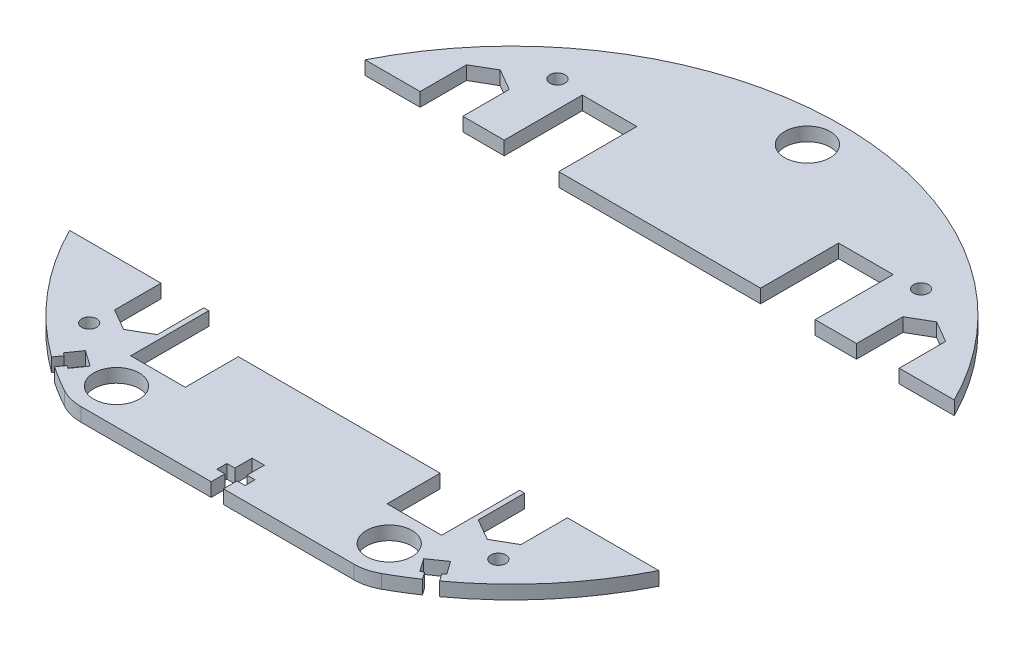
from build123d import *

# Parameters (mm, degrees)
BOSS_EXTRUDE1_DEPTH = 3
CUT_EXTRUDE1_DEPTH  = 103.574363269
CUT_EXTRUDE2_DEPTH  = 103.574363269
SKETCH4_R           = 5
CUT_EXTRUDE3_DEPTH  = 98.289516393
CUT_EXTRUDE4_DEPTH  = 98.289516393
SKETCH7_R           = 5
CUT_EXTRUDE6_DEPTH  = 98.289516393
CUT_EXTRUDE7_DEPTH  = 98.289516393
SKETCH9_R           = 1.65
CUT_EXTRUDE8_DEPTH  = 98.289516393
CUT_EXTRUDE9_DEPTH  = 98.289516393


with BuildPart() as part:
    # Sketch1 → Boss-Extrude1 (new body)
    with BuildSketch(Plane(origin=(0, 0, 0), x_dir=(1, 0, 0), z_dir=(0, 1, 0))):
        with BuildLine():
            Line((-30.029977361, -64.812867647), (30.029977361, -64.812867647))
            ThreePointArc((30.029977361, -64.812867647), (32.509837414, -64.500503794), (34.834773739, -63.582926471))
            ThreePointArc((34.834773739, -63.582926471), (0, 72.5), (-34.834773739, -63.582926471))
            ThreePointArc((-34.834773739, -63.582926471), (-32.509837414, -64.500503794), (-30.029977361, -64.812867647))
        make_face()
    extrude(amount=BOSS_EXTRUDE1_DEPTH)

    # Sketch2 → Cut-Extrude1 (cut, through all)
    with BuildSketch(Plane(origin=(0, 3, 0), x_dir=(1, 0, 0), z_dir=(0, 1, 0))):
        Polygon((-34.2, 49.675685802), (-34.2, -49.675685802), (-22.2, -49.675685802), (-22.2, -38), (22.2, -38), (22.2, -49.675685802), (34.2, -49.675685802), (34.2, 49.675685802), (22.2, 49.675685802), (22.2, 32.5), (19, 32.5), (19, 28.200685802), (-19, 28.200685802), (-19, 32.5), (-22.2, 32.5), (-22.2, 49.675685802), align=None)
    extrude(amount=-CUT_EXTRUDE1_DEPTH, mode=Mode.SUBTRACT)

    # Sketch3 → Cut-Extrude2 (cut, through all)
    with BuildSketch(Plane(origin=(0, 3, 0), x_dir=(1, 0, 0), z_dir=(0, 1, 0))):
        Polygon((34.2, -32.5), (-34.2, -32.5), (-72.5, -32.5), (-72.5, 32.5), (-34.2, 32.5), (34.2, 32.5), (72.5, 32.5), (72.5, -32.5), align=None)
    extrude(amount=-CUT_EXTRUDE2_DEPTH, mode=Mode.SUBTRACT)


with BuildPart() as cut_extrude2_piece_1:
    # of the separate pieces the step leaves, piece 1, a body of its own (cut_extrude2_pieces)
    add(part.part.solids().sort_by_distance((64.807406984, 0, -32.5))[0])


with BuildPart() as cut_extrude2_piece_2:
    # of the separate pieces the step leaves, piece 2, a body of its own (cut_extrude2_pieces)
    add(part.part.solids().sort_by_distance((-34.834773739, 0, 63.582926471))[0])

    # Sketch4 → Cut-Extrude3 (cut, through all)
    with BuildSketch(Plane(origin=(0, 3, 0), x_dir=(1, 0, 0), z_dir=(0, 1, 0))):
        with Locations((30, -57)):
            Circle(SKETCH4_R)
        with Locations((-30, -57)):
            Circle(SKETCH4_R)
    extrude(amount=-CUT_EXTRUDE3_DEPTH, mode=Mode.SUBTRACT)


with BuildPart() as cut_extrude4_tool:
    # Sketch5 → Cut-Extrude4 (new, through all)
    with BuildSketch(Plane(origin=(0, 3, 0), x_dir=(1, 0, 0), z_dir=(0, 1, 0))):
        Polygon((-52.7, 37.286453735), (-52.7, 32.5), (-43.3, 32.5), (-43.3, 37.286453735), (-43.3, 42.713546265), (-48, 45.42709253), (-52.7, 42.713546265), align=None)
        Polygon((-44.7, -37.286453735), (-44.7, -32.5), (-35.3, -32.5), (-35.3, -37.286453735), (-35.3, -42.713546265), (-40, -45.42709253), (-44.7, -42.713546265), align=None)
        Polygon((35.3, -32.5), (44.7, -32.5), (44.7, -37.286453735), (44.7, -42.713546265), (40, -45.42709253), (35.3, -42.713546265), (35.3, -37.286453735), align=None)
        Polygon((43.3, 37.286453735), (43.3, 42.713546265), (48, 45.42709253), (52.7, 42.713546265), (52.7, 37.286453735), (52.7, 32.5), (43.3, 32.5), align=None)
    extrude(amount=-CUT_EXTRUDE4_DEPTH)


with BuildPart() as cut_extrude2_piece_1_1:
    add(cut_extrude2_piece_1.part)

    # Cut-Extrude4: cut by cut_extrude4_tool
    add(cut_extrude4_tool.part, mode=Mode.SUBTRACT)

    # Sketch7 → Cut-Extrude6 (cut, through all)
    with BuildSketch(Plane(origin=(0, 3, 0), x_dir=(1, 0, 0), z_dir=(0, 1, 0))):
        with Locations((0, 65)):
            Circle(SKETCH7_R)
    extrude(amount=-CUT_EXTRUDE6_DEPTH, mode=Mode.SUBTRACT)


with BuildPart() as cut_extrude2_piece_2_1:
    add(cut_extrude2_piece_2.part)

    # Cut-Extrude4: cut by cut_extrude4_tool
    add(cut_extrude4_tool.part, mode=Mode.SUBTRACT)

    # Sketch8 → Cut-Extrude7 (cut, through all)
    with BuildSketch(Plane(origin=(0, 3, 0), x_dir=(1, 0, 0), z_dir=(0, 1, 0))):
        Polygon((-1.35, -64.812867647), (-1.35, -61.812867647), (-3.1, -61.812867647), (-3.1, -59.612867647), (-1.35, -59.612867647), (-1.35, -55.812867647), (1.35, -55.812867647), (1.35, -59.612867647), (3.1, -59.612867647), (3.1, -61.812867647), (1.35, -61.812867647), (1.35, -64.812867647), align=None)
    extrude(amount=-CUT_EXTRUDE7_DEPTH, mode=Mode.SUBTRACT)


with BuildPart() as cut_extrude8_tool:
    # Sketch9 → Cut-Extrude8 (new, through all)
    with BuildSketch(Plane(origin=(0, 3, 0), x_dir=(1, 0, 0), z_dir=(0, 1, 0))):
        with Locations((45, -48)):
            Circle(SKETCH9_R)
        with Locations((-45, -48)):
            Circle(SKETCH9_R)
        with Locations((40, 50)):
            Circle(SKETCH9_R)
        with Locations((-40, 50)):
            Circle(SKETCH9_R)
    extrude(amount=-CUT_EXTRUDE8_DEPTH)


with BuildPart() as cut_extrude2_piece_1_2:
    add(cut_extrude2_piece_1_1.part)

    # Cut-Extrude8: cut by cut_extrude8_tool
    add(cut_extrude8_tool.part, mode=Mode.SUBTRACT)


with BuildPart() as cut_extrude2_piece_2_2:
    add(cut_extrude2_piece_2_1.part)

    # Cut-Extrude8: cut by cut_extrude8_tool
    add(cut_extrude8_tool.part, mode=Mode.SUBTRACT)

    # Sketch10 → Cut-Extrude9 (cut, through all)
    with BuildSketch(Plane(origin=(0, 3, 0), x_dir=(1, 0, 0), z_dir=(0, 1, 0))):
        Polygon((36.688923141, -56.102036895), (40.17031933, -53.66433704), (42.177836857, -56.531369195), (41.542994023, -56.975890933), (42.690146895, -58.614195022), (40.478436376, -60.1628514), (39.331283503, -58.524547311), (38.696440669, -58.96906905), align=None)
        Polygon((-41.542994023, -56.975890933), (-42.177836857, -56.531369195), (-40.17031933, -53.66433704), (-36.688923141, -56.102036895), (-38.696440669, -58.96906905), (-39.331283503, -58.524547311), (-40.478436376, -60.1628514), (-42.690146895, -58.614195022), align=None)
    extrude(amount=-CUT_EXTRUDE9_DEPTH, mode=Mode.SUBTRACT)


solid = Compound([cut_extrude2_piece_1_2.part, cut_extrude2_piece_2_2.part])
